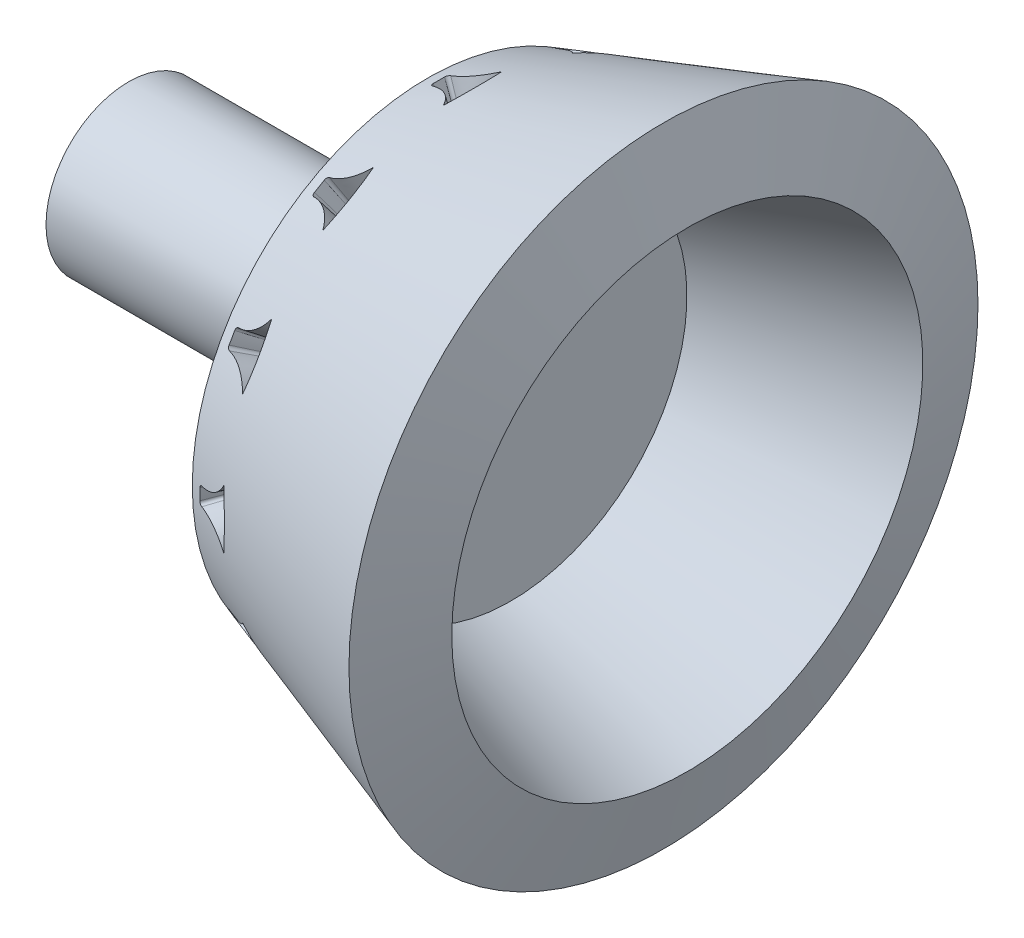
from build123d import *

# Parameters (mm, degrees)
TEETHCUTS_COUNT = 12
TEETHCUTS_ANGLE = 330
HUBSKE_R        = 9.899008976
HUB_DEPTH       = 35.900075776
BORSKE_R        = 0.4
BORE_DEPTH      = 50.001016


with BuildPart() as part:
    # BasProSke → Base-Revolve (revolve)
    with BuildSketch(Plane(origin=(0, 0, 0), x_dir=(1, 0, 0), z_dir=(0, 1, 0)), mode=Mode.PRIVATE) as base_revolve_sk:
        Polygon((0, 0), (0, 28.243802374), (28.303941168, 37.747810839), (31.165940514, 28.26695176), (9.970906369, 21.15), (9.970906369, 0), align=None)
    revolve(base_revolve_sk.sketch.rotate(Axis((-10, 0, 0), (1, 0, 0)), 180), axis=Axis((-10, 0, 0), (1, 0, 0)))

    # ToothCut: read off the stored shape, not the designer's step
    # ToothCut: loft between two sections, ruled curve by curve
    toothcut_from = [
        Edge.make_bspline([(8.225888886, 13.10418508, 0.010210843), (8.232998652, 13.106572426, 0.004664084), (8.232998652, 13.106572426, -0.004664084), (8.225888886, 13.10418508, -0.010210843)], [0, 0, 0, 0, 1, 1, 1, 1], 3, [1, 0.729749782, 0.729749782, 1]),
        Edge.make_bspline([(8.225888886, 13.10418508, -0.010210843), (8.220545959, 13.102391012, -0.014379184), (8.213941892, 13.100173472, -0.013598533), (8.209606109, 13.098717586, -0.008286096)], [0, 0, 0, 0, 1, 1, 1, 1], 3, [1, 0.821855949, 0.821855949, 1]),
        Edge.make_bspline([(8.209606109, 13.098717586, 0.008286096), (8.213941892, 13.100173472, 0.013598533), (8.220545959, 13.102391012, 0.014379184), (8.225888886, 13.10418508, 0.010210843)], [0, 0, 0, 0, 1, 1, 1, 1], 3, [1, 0.821855949, 0.821855949, 1]),
        Edge.make_bspline([(8.209606109, 13.098717586, -0.008286096), (8.208787328, 13.098442652, -0.007282881), (8.208125952, 13.098220573, -0.00615785), (8.207637987, 13.098056722, -0.004938229)], [0, 0, 0, 0, 1, 1, 1, 1], 3, [1, 0.991933312, 0.991933312, 1]),
        Edge.make_bspline([(8.207637987, 13.098056722, 0.004938229), (8.208125952, 13.098220573, 0.00615785), (8.208787328, 13.098442652, 0.007282881), (8.209606109, 13.098717586, 0.008286096)], [0, 0, 0, 0, 1, 1, 1, 1], 3, [1, 0.991933312, 0.991933312, 1]),
        Edge.make_bspline([(8.207637987, 13.098056722, -0.004938229), (8.206357273, 13.097626679, -0.001737215), (8.206357273, 13.097626679, 0.001737215), (8.207637987, 13.098056722, 0.004938229)], [0, 0, 0, 0, 1, 1, 1, 1], 3, [1, 0.94753772, 0.94753772, 1]),
    ]
    toothcut_to = [
        Edge.make_bspline([(5.362478994, 30.04443662, 3.551401949), (5.932609824, 30.235877388, 1.209126879), (5.932609824, 30.235877388, -1.209126879), (5.362478994, 30.04443662, -3.551401949)], [0, 0, 0, 0, 1, 1, 1, 1], 3, [1, 0.979054118, 0.979054118, 1]),
        Edge.make_bspline([(5.362478994, 30.04443662, -3.551401949), (4.597914643, 29.787708201, -2.089112638), (3.262478878, 29.339290338, -1.192289974), (1.682944412, 28.808908055, -1.08038081)], [0, 0, 0, 0, 1, 1, 1, 1], 3, [1, 0.918435434, 0.918435434, 1]),
        Edge.make_bspline([(1.682944412, 28.808908055, 1.08038081), (3.262478878, 29.339290338, 1.192289974), (4.597914643, 29.787708201, 2.089112638), (5.362478994, 30.04443662, 3.551401949)], [0, 0, 0, 0, 1, 1, 1, 1], 3, [1, 0.918435434, 0.918435434, 1]),
        Edge.make_bspline([(1.682944412, 28.808908055, -1.08038081), (1.473494319, 28.738578081, -1.065541384), (1.335608279, 28.692278165, -0.898569491), (1.350391578, 28.697242159, -0.677678866)], [0, 0, 0, 0, 1, 1, 1, 1], 3, [1, 0.8039316, 0.8039316, 1]),
        Edge.make_bspline([(1.350391578, 28.697242159, 0.677678866), (1.335608279, 28.692278165, 0.898569491), (1.473494319, 28.738578081, 1.065541384), (1.682944412, 28.808908055, 1.08038081)], [0, 0, 0, 0, 1, 1, 1, 1], 3, [1, 0.8039316, 0.8039316, 1]),
        Edge.make_bspline([(1.350391578, 28.697242159, -0.677678866), (1.380602683, 28.707386562, -0.226267469), (1.380602683, 28.707386562, 0.226267469), (1.350391578, 28.697242159, 0.677678866)], [0, 0, 0, 0, 1, 1, 1, 1], 3, [1, 0.99834482, 0.99834482, 1]),
    ]
    toothcut = Solid(Shell([*[Face.make_surface_from_curves(toothcut_from[k], toothcut_to[k]) for k in range(6)], Face(Wire(toothcut_from)), Face(Wire(toothcut_to))]))
    add(toothcut, mode=Mode.SUBTRACT)

    # TeethCuts: ToothCut ×12 about axis
    teethcuts_axis = Axis((-10, 0, 0), (1, 0, 0))
    for i in range(1, TEETHCUTS_COUNT):
        add(toothcut.rotate(teethcuts_axis, i * TEETHCUTS_ANGLE / (TEETHCUTS_COUNT - 1)), mode=Mode.SUBTRACT)

    # HubSke → Hub (add)
    with BuildSketch(Plane.ZY):
        with Locations(Location((0, 0, 0), (0, 0, 180))):
            Circle(HUBSKE_R)
    extrude(amount=HUB_DEPTH)

    # BorSke → Bore (cut, symmetric)
    with BuildSketch(Plane(origin=(0, 0, 0), x_dir=(0, 0, -1), z_dir=(1, 0, 0))):
        with Locations(Location((0, 0, 0), (0, 0, 180))):
            Circle(BORSKE_R)
    extrude(amount=BORE_DEPTH, both=True, mode=Mode.SUBTRACT)


solid = part.part
